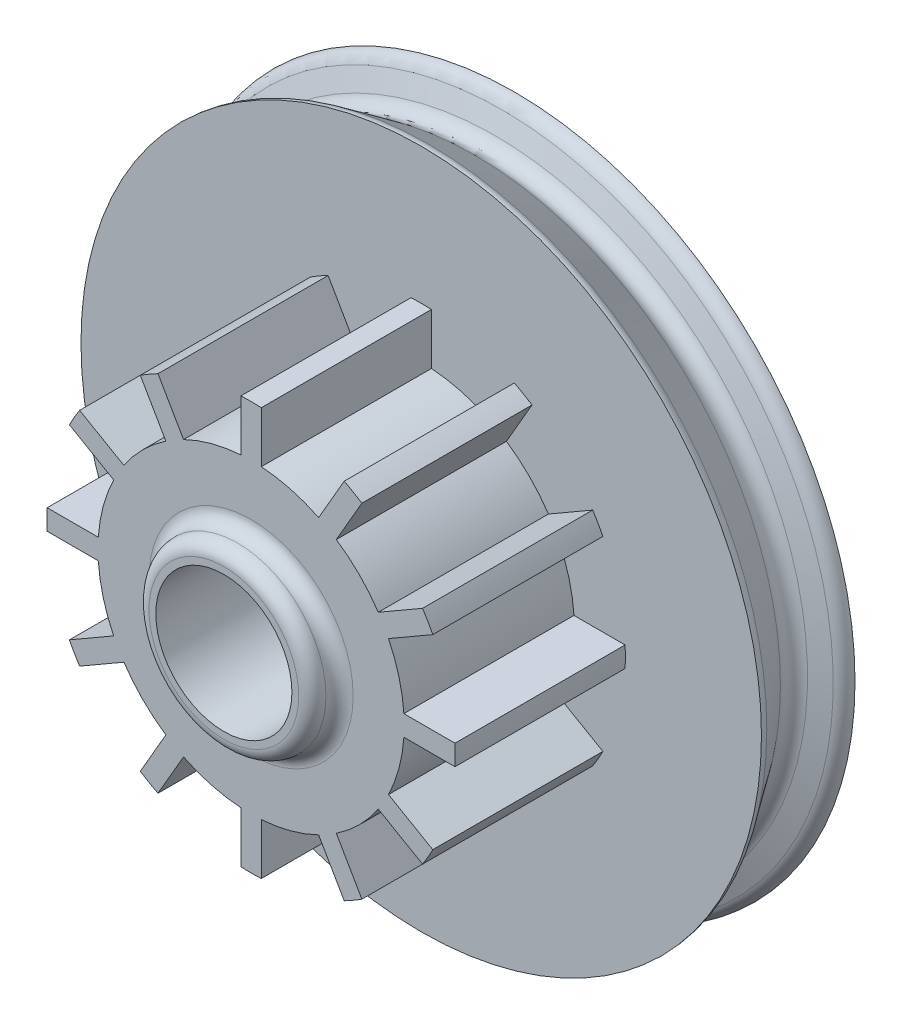
from build123d import *

# Parameters (mm, degrees)
CUT_EXTRUDE1_START  = -10
CUT_EXTRUDE1_DEPTH  = 10
CIRPATTERN1_COUNT   = 12
SKETCH4_R           = 14
SKETCH4_R_2         = 7
CUT_EXTRUDE2_DEPTH  = 3.1
FILLET1_R           = 1
BOSS_EXTRUDE1_START = 1.6
SKETCH5_R           = 5.2
SKETCH5_R_2         = 4
BOSS_EXTRUDE1_DEPTH = 1.6
FILLET2_R           = 0.8


with BuildPart() as part:
    # Sketch2 → Revolve1 (revolve)
    with BuildSketch(Plane(origin=(0, 0, 0), x_dir=(0, 0, -1), z_dir=(1, 0, 0)), mode=Mode.PRIVATE) as revolve1_sk:
        with BuildLine():
            Line((0, 4), (-15.5, 4))
            Line((-15.5, 4), (-15.5, 12))
            Line((-15.5, 12), (-5.5, 12))
            Line((-5.5, 12), (-5.5, 20))
            ThreePointArc((-5.5, 20), (-5.25943536, 19.962973561), (-5.041138851, 19.855321635))
            Line((-5.041138851, 19.855321635), (-2.366224855, 17.982326692))
            ThreePointArc((-2.366224855, 17.982326692), (-1.666799067, 17.874674766), (-1.155609609, 18.364032212))
            Line((-1.155609609, 18.364032212), (-0.751754097, 19.473616115))
            ThreePointArc((-0.751754097, 19.473616115), (-0.458861149, 19.855321635), (0, 20))
            Line((0, 20), (0, 4))
        make_face()
    revolve(revolve1_sk.sketch.rotate(Axis((0, 0, 0), (0, 0, 1)), 90), axis=Axis((0, 0, 0), (0, 0, 1)))

    # Sketch3 → Cut-Extrude1 (cut)
    with BuildSketch(Plane.XY.offset(15.5).offset(CUT_EXTRUDE1_START)):
        with BuildLine():
            ThreePointArc((5.472880064, 10.679306335), (3.105828541, 11.591109915), (0.6, 11.984990613))
            Line((0.6, 11.984990613), (0.6, 8.979977728))
            ThreePointArc((0.6, 8.979977728), (2.329371406, 8.693332437), (3.970373622, 8.076888838))
            Line((3.970373622, 8.076888838), (5.472880064, 10.679306335))
        make_face()
    cut_extrude1 = extrude(amount=CUT_EXTRUDE1_DEPTH, mode=Mode.SUBTRACT)

    # CirPattern1: Cut-Extrude1 ×12 about axis
    cirpattern1_axis = Axis((0, 0, 0), (0, 0, 1))
    for i in range(1, CIRPATTERN1_COUNT):
        add(cut_extrude1.rotate(cirpattern1_axis, i * 360 / CIRPATTERN1_COUNT), mode=Mode.SUBTRACT)

    # Sketch4 → Cut-Extrude2 (cut)
    with BuildSketch(Plane(origin=(0, 0, 0), x_dir=(-1, 0, 0), z_dir=(0, 0, -1))):
        Circle(SKETCH4_R)
        Circle(SKETCH4_R_2, mode=Mode.SUBTRACT)
    extrude(amount=-CUT_EXTRUDE2_DEPTH, mode=Mode.SUBTRACT)

    # Fillet1
    fillet1_edges = [part.edges().sort_by_distance(p)[0] for p in [
        (14, 0, 3.1),
        (7, 0, 0),
        (14, 0, 0),
        (7, 0, 3.1),
    ]]
    fillet(fillet1_edges, radius=FILLET1_R)

    # Sketch5 → Boss-Extrude1 (add)
    with BuildSketch(Plane.XY.offset(15.5).offset(BOSS_EXTRUDE1_START)):
        Circle(SKETCH5_R)
        with Locations(Location((0, 0, 0), (0, 0, 180))):
            Circle(SKETCH5_R_2, mode=Mode.SUBTRACT)
    extrude(amount=-BOSS_EXTRUDE1_DEPTH)

    # Fillet2
    fillet2_edges = [part.edges().sort_by_distance(p)[0] for p in [
        (-5.2, 0, 17.1),
        (-5.2, 0, 15.5),
    ]]
    fillet(fillet2_edges, radius=FILLET2_R - 0.0001)  # a hair under: the kernel refuses the full size


solid = part.part
